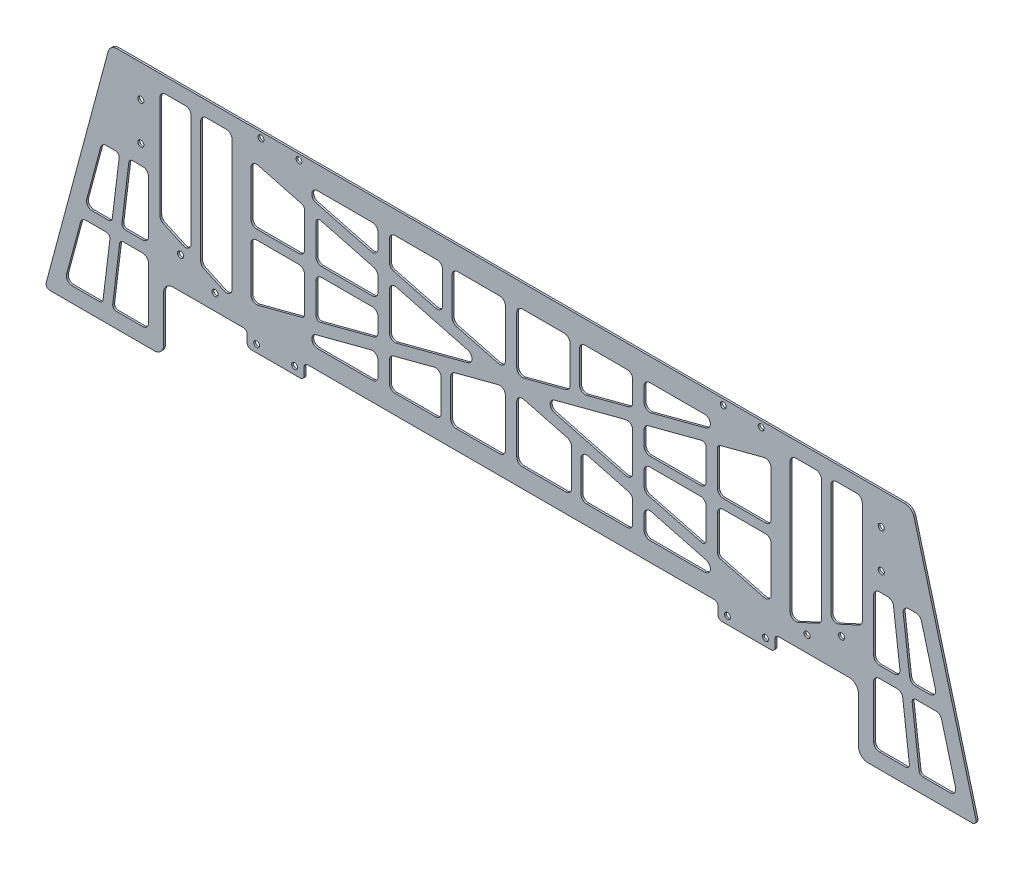
from build123d import *

# Parameters (mm, degrees)
SKETCH_1_W          = 600
SKETCH_1_H          = 94
EXTRUDE_1_DEPTH     = 1
CUT_EXTRUDE_1_DEPTH = 2
SKETCH_4_W          = 30
SKETCH_4_H          = 16
SKETCH_4_R          = 1.55
EXTRUDE_2_DEPTH     = 1
EXTRUDE_3_DEPTH     = 1
SKETCH_6_R          = 1.6
CUT_EXTRUDE_2_DEPTH = 10
SKETCH_7_R          = 1.6
CUT_EXTRUDE_3_DEPTH = 10
CUT_EXTRUDE_4_DEPTH = 10
CUT_EXTRUDE_5_DEPTH = 10
CUT_EXTRUDE_6_DEPTH = 10
SKETCH_12_W         = 6
SKETCH_12_H         = 72
EXTRUDE_5_DEPTH     = 1
SKETCH_13_W         = 6
SKETCH_13_H         = 72
EXTRUDE_6_DEPTH     = 1
FILLET_1_R          = 3
EXTRUDE_7_DEPTH     = 1
FILLET_2_R          = 2
FILLET_3_R          = 2
FILLET_4_R          = 2
FILLET_5_R          = 5
EXTRUDE_8_DEPTH     = 1
FILLET_6_R          = 2
FILLET_7_R          = 2
SKETCH_16_R         = 1.55
CUT_EXTRUDE_7_DEPTH = 10
SKETCH_17_W         = 66.902124147
SKETCH_17_H         = 5
EXTRUDE_9_DEPTH     = 1
EXTRUDE_10_DEPTH    = 1
FILLET_8_R          = 3


with BuildPart() as part:
    # 草图1 → 凸台-拉伸1 (new body)
    with BuildSketch(Plane.XY):
        Rectangle(SKETCH_1_W, SKETCH_1_H)
    extrude(amount=EXTRUDE_1_DEPTH)

    # 草图3 → 切除-拉伸1 (cut)
    with BuildSketch(Plane(origin=(0, 0, 0), x_dir=(-1, 0, 0), z_dir=(0, 0, -1))):
        Polygon((236.458514681, -47), (211.271290593, 47), (300, 47), (300, -47), align=None)
    cut_extrude_1 = extrude(amount=-CUT_EXTRUDE_1_DEPTH, mode=Mode.SUBTRACT)

    # 镜向1: 切除-拉伸1 across plane
    add(cut_extrude_1.mirror(Plane(origin=(0, 0, 0), x_dir=(0, 0, 1), z_dir=(1, 0, 0))), mode=Mode.SUBTRACT)

    # 草图4 → 凸台-拉伸2 (add)
    with BuildSketch(Plane(origin=(0, 0, 0), x_dir=(-1, 0, 0), z_dir=(0, 0, -1))):
        with Locations((124, -47)):
            Rectangle(SKETCH_4_W, SKETCH_4_H)
        with Locations((114, -51)):
            Circle(SKETCH_4_R, mode=Mode.SUBTRACT)
        with Locations((134, -51)):
            Circle(SKETCH_4_R, mode=Mode.SUBTRACT)
    extrude_2 = extrude(amount=-EXTRUDE_2_DEPTH)

    # 镜向2: 凸台-拉伸2 across plane
    add(extrude_2.mirror(Plane(origin=(0, 0, 0), x_dir=(0, 0, 1), z_dir=(1, 0, 0))))

    # 草图5 → 凸台-拉伸3 (add)
    with BuildSketch(Plane(origin=(0, 0, 0), x_dir=(-1, 0, 0), z_dir=(0, 0, -1))):
        Polygon((-236.458514681, -47), (-245.568787224, -81), (-183, -81), (-183, -47), align=None)
    extrude_3 = extrude(amount=-EXTRUDE_3_DEPTH)

    # 镜向3: 凸台-拉伸3 across plane
    add(extrude_3.mirror(Plane(origin=(0, 0, 0), x_dir=(0, 0, 1), z_dir=(1, 0, 0))))

    # 草图6 → 切除-拉伸2 (cut)
    with BuildSketch(Plane.XY.offset(1)):
        with Locations((-195, 30)):
            Circle(SKETCH_6_R)
        with Locations((-195, 10)):
            Circle(SKETCH_6_R)
    cut_extrude_2 = extrude(amount=-CUT_EXTRUDE_2_DEPTH, mode=Mode.SUBTRACT)

    # 镜向4: 切除-拉伸2 across plane
    add(cut_extrude_2.mirror(Plane(origin=(0, 0, 0), x_dir=(0, 0, 1), z_dir=(1, 0, 0))), mode=Mode.SUBTRACT)

    # 草图7 → 切除-拉伸3 (cut)
    with BuildSketch(Plane(origin=(0, 0, 0), x_dir=(-1, 0, 0), z_dir=(0, 0, -1))):
        with Locations((-155.938799152, -38.647210915)):
            Circle(SKETCH_7_R)
        with Locations((-174.097986842, -30.266047366)):
            Circle(SKETCH_7_R)
    cut_extrude_3 = extrude(amount=-CUT_EXTRUDE_3_DEPTH, mode=Mode.SUBTRACT)

    # 镜向5: 切除-拉伸3 across plane
    add(cut_extrude_3.mirror(Plane(origin=(0, 0, 0), x_dir=(0, 0, 1), z_dir=(1, 0, 0))), mode=Mode.SUBTRACT)

    # 草图8 → 切除-拉伸4 (cut)
    with BuildSketch(Plane(origin=(0, 0, 0), x_dir=(-1, 0, 0), z_dir=(0, 0, -1))):
        Polygon((-191, -39.5), (-226.166686295, -39.5), (-235.142984241, -73), (-191, -73), align=None)
        Polygon((-215.582693194, 0), (-224.55899114, -33.5), (-191, -33.5), (-191, 0), align=None)
    cut_extrude_4 = extrude(amount=-CUT_EXTRUDE_4_DEPTH, mode=Mode.SUBTRACT)

    # 镜向6: 切除-拉伸4 across plane
    add(cut_extrude_4.mirror(Plane(origin=(0, 0, 0), x_dir=(0, 0, 1), z_dir=(1, 0, 0))), mode=Mode.SUBTRACT)

    # 草图9 → 切除-拉伸5 (cut)
    with BuildSketch(Plane(origin=(0, 0, 0), x_dir=(-1, 0, 0), z_dir=(0, 0, -1))):
        Polygon((-147, 39), (-163.5, 39), (-163.5, -29.650571653), (-147, -37.265956269), align=None)
        Polygon((-168.5, 39), (-185, 39), (-185, -19.72749473), (-168.5, -27.342879346), align=None)
    cut_extrude_5 = extrude(amount=-CUT_EXTRUDE_5_DEPTH, mode=Mode.SUBTRACT)

    # 镜向7: 切除-拉伸5 across plane
    add(cut_extrude_5.mirror(Plane(origin=(0, 0, 0), x_dir=(0, 0, 1), z_dir=(1, 0, 0))), mode=Mode.SUBTRACT)

    # 草图10 → 切除-拉伸6 (cut)
    with BuildSketch(Plane(origin=(0, 0, 0), x_dir=(-1, 0, 0), z_dir=(0, 0, -1))):
        Polygon((-11.804248294, -1), (-137, 31.898153733), (-137, -33.898153733), align=None)
        Polygon((125.195751706, -37), (0, -4.101846267), (-125.195751706, -37), align=None)
        Polygon((137, 31.898153733), (11.804248294, -1), (137, -33.898153733), align=None)
        Polygon((125.195751706, 35), (-125.195751706, 35), (0, 2.101846267), align=None)
    extrude(amount=-CUT_EXTRUDE_6_DEPTH, mode=Mode.SUBTRACT)

    # 草图12 → 凸台-拉伸5 (add)
    with BuildSketch(Plane(origin=(0, 0, 0), x_dir=(-1, 0, 0), z_dir=(0, 0, -1))):
        with Locations((0, -1)):
            Rectangle(SKETCH_12_W, SKETCH_12_H)
    extrude(amount=-EXTRUDE_5_DEPTH)

    # 草图13 → 凸台-拉伸6 (add)
    with BuildSketch(Plane(origin=(0, 0, 0), x_dir=(-1, 0, 0), z_dir=(0, 0, -1))):
        with Locations((-67.097875853, -1)):
            Rectangle(SKETCH_13_W, SKETCH_13_H)
    extrude_6 = extrude(amount=-EXTRUDE_6_DEPTH)

    # 镜向8: 凸台-拉伸6 across plane
    add(extrude_6.mirror(Plane(origin=(0, 0, 0), x_dir=(0, 0, 1), z_dir=(1, 0, 0))))

    # 圆角1
    fillet_1_edges = [part.edges().sort_by_distance(p)[0] for p in [
        (226.166686295, -39.5, 0.5),
        (191, -39.5, 0.5),
        (191, -73, 0.5),
        (235.142984241, -73, 0.5),
        (224.55899114, -33.5, 0.5),
        (215.582693194, 0, 0.5),
        (191, 0, 0.5),
        (191, -33.5, 0.5),
        (-191, -39.5, 0.5),
        (-226.166686295, -39.5, 0.5),
        (-235.142984241, -73, 0.5),
        (-191, -73, 0.5),
        (-215.582693194, 0, 0.5),
        (-224.55899114, -33.5, 0.5),
        (-191, -33.5, 0.5),
        (-191, 0, 0.5),
        (163.5, 39, 0.5),
        (147, 39, 0.5),
        (147, -37.265956269, 0.5),
        (163.5, -29.650571653, 0.5),
        (168.5, 39, 0.5),
        (168.5, -27.342879346, 0.5),
        (185, -19.72749473, 0.5),
        (185, 39, 0.5),
        (-147, 39, 0.5),
        (-163.5, 39, 0.5),
        (-163.5, -29.650571653, 0.5),
        (-147, -37.265956269, 0.5),
        (-168.5, -27.342879346, 0.5),
        (-168.5, 39, 0.5),
        (-185, 39, 0.5),
        (-185, -19.72749473, 0.5),
        (-11.804248294, -1, 0.5),
        (-137, 31.898153733, 0.5),
        (-137, -33.898153733, 0.5),
        (-125.195751706, -37, 0.5),
        (125.195751706, -37, 0.5),
        (125.195751706, 35, 0.5),
        (-125.195751706, 35, 0.5),
        (137, 31.898153733, 0.5),
        (11.804248294, -1, 0.5),
        (137, -33.898153733, 0.5),
        (3, -4.890167435, 0.5),
        (-3, 2.890167435, 0.5),
        (-3, 35, 0.5),
        (3, -37, 0.5),
        (3, 35, 0.5),
        (-3, -4.890167435, 0.5),
        (-3, -37, 0.5),
        (3, 2.890167435, 0.5),
        (70.097875853, -22.521726053, 0.5),
        (64.097875853, -20.945083717, 0.5),
        (64.097875853, 18.945083717, 0.5),
        (64.097875853, 35, 0.5),
        (70.097875853, 20.521726053, 0.5),
        (70.097875853, -37, 0.5),
        (70.097875853, 35, 0.5),
        (64.097875853, 12.741391184, 0.5),
        (64.097875853, -14.741391184, 0.5),
        (64.097875853, -37, 0.5),
        (70.097875853, 14.318033519, 0.5),
        (70.097875853, -16.318033519, 0.5),
        (-70.097875853, -16.318033519, 0.5),
        (-64.097875853, -14.741391184, 0.5),
        (-64.097875853, 18.945083717, 0.5),
        (-64.097875853, -20.945083717, 0.5),
        (-64.097875853, 12.741391184, 0.5),
        (-70.097875853, 20.521726053, 0.5),
        (-70.097875853, -22.521726053, 0.5),
        (-70.097875853, 14.318033519, 0.5),
        (-70.097875853, 35, 0.5),
        (-64.097875853, -37, 0.5),
        (-70.097875853, -37, 0.5),
        (-64.097875853, 35, 0.5),
    ]]
    fillet(fillet_1_edges, radius=FILLET_1_R)

    # 草图14 → 凸台-拉伸7 (add)
    with BuildSketch(Plane(origin=(0, 0, 0), x_dir=(-1, 0, 0), z_dir=(0, 0, -1))):
        Polygon((-108.786500559, 24.484387456), (-108.786500559, -26.484387456), (-102.786500559, -24.907745121), (-102.786500559, 22.907745121), align=None)
    extrude_7 = extrude(amount=-EXTRUDE_7_DEPTH)

    # 镜向9: 凸台-拉伸7 across plane
    add(extrude_7.mirror(Plane(origin=(0, 0, 0), x_dir=(0, 0, 1), z_dir=(1, 0, 0))))

    # 圆角2
    fillet_2_edges = [part.edges().sort_by_distance(p)[0] for p in [
        (108.786500559, 24.484387456, 0.5),
        (102.786500559, 22.907745121, 0.5),
        (102.786500559, -24.907745121, 0.5),
        (108.786500559, -26.484387456, 0.5),
        (-102.786500559, -24.907745121, 0.5),
        (-108.786500559, -26.484387456, 0.5),
        (-108.786500559, 24.484387456, 0.5),
        (-102.786500559, 22.907745121, 0.5),
    ]]
    fillet(fillet_2_edges, radius=FILLET_2_R)

    # 圆角3
    fillet_3_edges = [part.edges().sort_by_distance(p)[0] for p in [
        (245.568787224, -81, 0.5),
        (-245.568787224, -81, 0.5),
    ]]
    fillet(fillet_3_edges, radius=FILLET_3_R)

    # 圆角4
    fillet_4_edges = [part.edges().sort_by_distance(p)[0] for p in [
        (-109, -55, 0.5),
        (-109, -47, 0.5),
        (-139, -55, 0.5),
        (-139, -47, 0.5),
        (139, -47, 0.5),
        (139, -55, 0.5),
        (109, -47, 0.5),
        (109, -55, 0.5),
    ]]
    fillet(fillet_4_edges, radius=FILLET_4_R)

    # 圆角5
    fillet_5_edges = [part.edges().sort_by_distance(p)[0] for p in [
        (183, -47, 0.5),
        (183, -81, 0.5),
        (-183, -81, 0.5),
        (-183, -47, 0.5),
        (-211.271290593, 47, 0.5),
        (211.271290593, 47, 0.5),
    ]]
    fillet(fillet_5_edges, radius=FILLET_5_R)

    # 草图15 → 凸台-拉伸8 (add)
    with BuildSketch(Plane.XY.offset(1)):
        Polygon((-206.159185079, 0), (-215.135483025, -73), (-210.135342273, -73.305109506), (-201.121527151, 0), align=None)
    extrude_8 = extrude(amount=-EXTRUDE_8_DEPTH)

    # 圆角6
    fillet_6_edges = [part.edges().sort_by_distance(p)[0] for p in [
        (-210.097825097, -73, 0.5),
        (-211.016223009, -39.5, 0.5),
        (-215.135483025, -73, 0.5),
        (-205.978565081, -39.5, 0.5),
        (-210.278445095, -33.5, 0.5),
        (-205.240787168, -33.5, 0.5),
        (-201.121527151, 0, 0.5),
        (-206.159185079, 0, 0.5),
    ]]
    fillet(fillet_6_edges, radius=FILLET_6_R)

    # 镜向20: 凸台-拉伸8 across plane
    add(extrude_8.mirror(Plane(origin=(0, 0, 0), x_dir=(0, 0, 1), z_dir=(1, 0, 0))))

    # 圆角7
    fillet_7_edges = [part.edges().sort_by_distance(p)[0] for p in [
        (210.097825097, -73, 0.5),
        (211.016223009, -39.5, 0.5),
        (215.135483025, -73, 0.5),
    ]]
    fillet(fillet_7_edges, radius=FILLET_7_R)

    # 草图16 → 切除-拉伸7 (cut)
    with BuildSketch(Plane(origin=(0, 0, 0), x_dir=(-1, 0, 0), z_dir=(0, 0, -1))):
        with Locations((-111.75, 44)):
            Circle(SKETCH_16_R)
        with Locations((-131.75, 44)):
            Circle(SKETCH_16_R)
        with Locations((131.75, 44)):
            Circle(SKETCH_16_R)
        with Locations((111.75, 44)):
            Circle(SKETCH_16_R)
    extrude(amount=-CUT_EXTRUDE_7_DEPTH, mode=Mode.SUBTRACT)

    # 草图17 → 凸台-拉伸9 (add)
    with BuildSketch(Plane(origin=(0, 0, 0), x_dir=(-1, 0, 0), z_dir=(0, 0, -1))):
        with Locations((-103.548937927, -1)):
            Rectangle(SKETCH_17_W, SKETCH_17_H)
        with Locations((103.548937927, -1)):
            Rectangle(SKETCH_17_W, SKETCH_17_H)
        Polygon((-36.811375295, -13.117974082), (-36.811375295, -37), (-31.811375295, -37), (-31.811375295, -12.461039775), align=None)
        Polygon((36.811375295, -13.117974082), (36.811375295, -37), (31.811375295, -37), (31.811375295, -12.461039775), align=None)
    extrude(amount=-EXTRUDE_9_DEPTH)

    # 草图18 → 凸台-拉伸10 (add)
    with BuildSketch(Plane(origin=(0, 0, 0), x_dir=(-1, 0, 0), z_dir=(0, 0, -1))):
        Polygon((-36.048937927, 35), (-36.048937927, 10.917625576), (-31.048937927, 10.26069127), (-31.048937927, 35), align=None)
        Polygon((36.048937927, 35), (36.048937927, 10.917625576), (31.048937927, 10.26069127), (31.048937927, 35), align=None)
    extrude(amount=-EXTRUDE_10_DEPTH)

    # 圆角8
    fillet_8_edges = [part.edges().sort_by_distance(p)[0] for p in [
        (210.278445095, -33.5, 0.5),
        (206.159185079, 0, 0.5),
        (205.240787168, -33.5, 0.5),
        (205.978565081, -39.5, 0.5),
        (201.121527151, 0, 0.5),
        (108.786500559, -3.5, 0.5),
        (108.786500559, 1.5, 0.5),
        (102.786500559, 1.5, 0.5),
        (102.786500559, -3.5, 0.5),
        (70.097875853, -3.5, 0.5),
        (137, -3.5, 0.5),
        (137, 1.5, 0.5),
        (70.097875853, 1.5, 0.5),
        (-108.786500559, 1.5, 0.5),
        (-108.786500559, -3.5, 0.5),
        (-137, -3.5, 0.5),
        (-70.097875853, 1.5, 0.5),
        (-137, 1.5, 0.5),
        (-102.786500559, -3.5, 0.5),
        (-70.097875853, -3.5, 0.5),
        (-102.786500559, 1.5, 0.5),
        (36.811375295, -37, 0.5),
        (31.811375295, -12.461039775, 0.5),
        (31.811375295, -37, 0.5),
        (36.811375295, -13.774908388, 0.5),
        (-31.811375295, -12.461039775, 0.5),
        (-36.811375295, -13.774908388, 0.5),
        (-36.811375295, -37, 0.5),
        (-31.811375295, -37, 0.5),
        (36.048937927, 35, 0.5),
        (31.048937927, 35, 0.5),
        (31.048937927, 10.26069127, 0.5),
        (36.048937927, 11.574559883, 0.5),
        (-31.048937927, 35, 0.5),
        (-36.048937927, 11.574559883, 0.5),
        (-36.048937927, 35, 0.5),
        (-31.048937927, 10.26069127, 0.5),
    ]]
    fillet(fillet_8_edges, radius=FILLET_8_R)


solid = part.part
